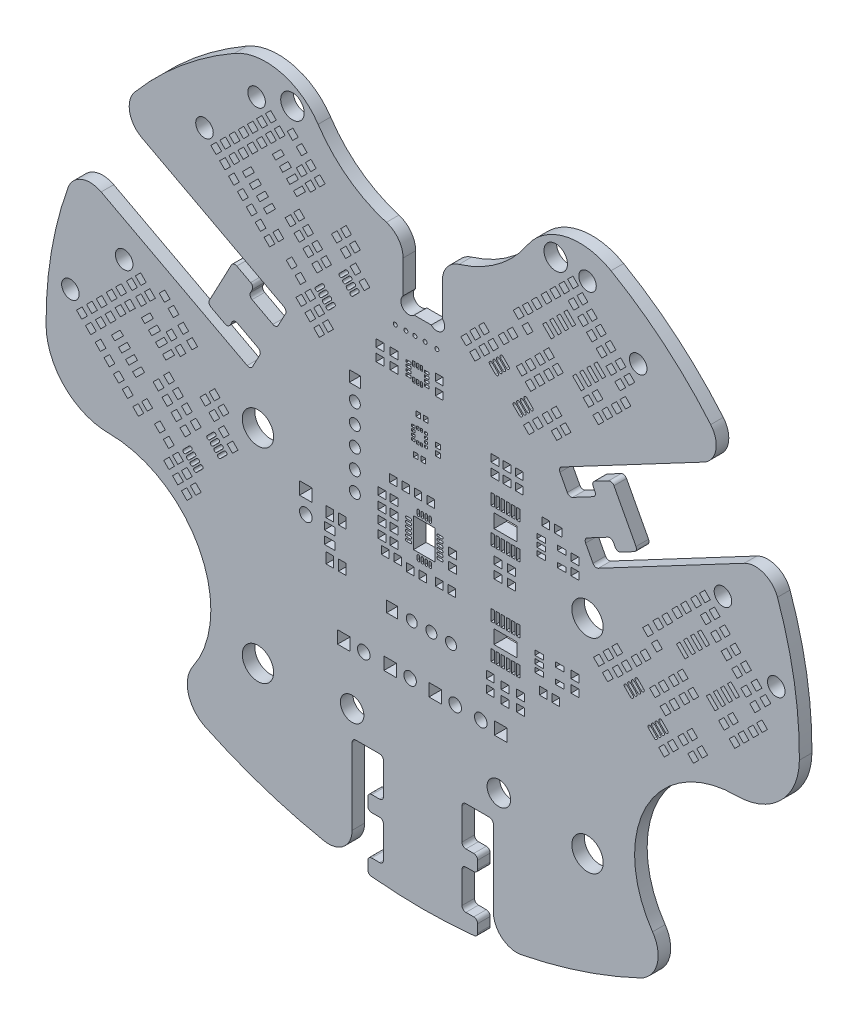
from build123d import *

# Parameters (mm, degrees)
MODEL_R            = 0.7
MODEL_R_2          = 2
MODEL_R_3          = 0.254
MODEL_R_4          = 1.1176
MODEL_R_5          = 1.5
MODEL_R_6          = 0.8
MODEL_W            = 1.4
MODEL_H            = 1.4
MODEL_W_2          = 0.4
MODEL_H_2          = 0.3
MODEL_W_3          = 0.3
MODEL_H_3          = 0.4
MODEL_W_4          = 1.1
MODEL_H_4          = 0.6
MODEL_W_5          = 0.64
MODEL_H_5          = 0.59
MODEL_W_6          = 0.59
MODEL_H_6          = 0.64
MODEL_W_7          = 0.95
MODEL_H_7          = 1.35
MODEL_W_8          = 1.35
MODEL_H_8          = 0.95
MODEL_W_9          = 2.75
MODEL_H_9          = 3.75
MODEL_W_10         = 0.45
MODEL_H_10         = 1.425
MODEL_W_11         = 2.947
MODEL_H_11         = 1.753
MODEL_W_12         = 0.6
MODEL_H_12         = 1
MODEL_W_13         = 1
MODEL_W_14         = 1.6
MODEL_H_13         = 1.6
BOSS_EXTRU_1_DEPTH = 1.6


with BuildPart() as part:
    # Model → Boss.-Extru.1 (new body)
    with BuildSketch(Plane.XY):
        with BuildLine():
            Line((0.6358, 50.4), (-1.5358, 50.4))
            ThreePointArc((-1.5358, 50.4), (-2.949992929, 50.400007071), (-2.95, 51.8142))
            Line((-2.95, 51.8142), (-2.95, 55.9955))
            ThreePointArc((-2.95, 55.9955), (-3.541133135, 57.783647085), (-5.0816, 58.8671))
            ThreePointArc((-5.0816, 58.8671), (-9.99733338, 61.34274159), (-13.7833, 65.3377))
            ThreePointArc((-13.7833, 65.3377), (-18.620170532, 68.703447655), (-24.4498, 67.8438))
            ThreePointArc((-24.4498, 67.8438), (-31.261898118, 63.079999891), (-37.15, 57.2124))
            ThreePointArc((-37.15, 57.2124), (-37.801472862, 54.707625216), (-36.261, 52.6279))
            Line((-36.261, 52.6279), (-18.142, 43.0271))
            ThreePointArc((-18.142, 43.0271), (-17.898173814, 42.732163839), (-17.9343, 42.3512))
            Line((-17.9343, 42.3512), (-18.8707, 40.584))
            ThreePointArc((-18.8707, 40.584), (-19.165676607, 40.340122008), (-19.5467, 40.3763))
            Line((-19.5467, 40.3763), (-22.1975, 41.7809))
            ThreePointArc((-22.1975, 41.7809), (-22.441333959, 42.075833772), (-22.4052, 42.4568))
            Line((-22.4052, 42.4568), (-22.1711, 42.8986))
            ThreePointArc((-22.1711, 42.8986), (-22.134971448, 43.279564566), (-22.3788, 43.5745))
            Line((-22.3788, 43.5745), (-24.1461, 44.5109))
            ThreePointArc((-24.1461, 44.5109), (-24.527065501, 44.547031594), (-24.822, 44.3032))
            Line((-24.822, 44.3032), (-27.6312, 39.0015))
            ThreePointArc((-27.6312, 39.0015), (-27.667331932, 38.620534395), (-27.4235, 38.3256))
            Line((-27.4235, 38.3256), (-25.6563, 37.3892))
            ThreePointArc((-25.6563, 37.3892), (-25.275332734, 37.353062661), (-24.9804, 37.5969))
            Line((-24.9804, 37.5969), (-24.7462, 38.0387))
            ThreePointArc((-24.7462, 38.0387), (-24.451265501, 38.282531594), (-24.0703, 38.2464))
            Line((-24.0703, 38.2464), (-21.4195, 36.8418))
            ThreePointArc((-21.4195, 36.8418), (-21.175666379, 36.546866124), (-21.2118, 36.1659))
            Line((-21.2118, 36.1659), (-22.1482, 34.3986))
            ThreePointArc((-22.1482, 34.3986), (-22.443135745, 34.154772462), (-22.8241, 34.1909))
            Line((-22.8241, 34.1909), (-41.4289, 44.0491))
            ThreePointArc((-41.4289, 44.0491), (-43.919422215, 44.1948424), (-45.659, 42.4066))
            ThreePointArc((-45.659, 42.4066), (-47.786015909, 34.239193824), (-48.4497, 25.8255))
            ThreePointArc((-48.4497, 25.8255), (-46.080470109, 20.216863723), (-40.45, 17.9))
            ThreePointArc((-40.45, 17.9), (-28.941954651, 10.946914919), (-29.7441, -2.4746))
            ThreePointArc((-29.7441, -2.4746), (-30.313200312, -5.780734401), (-28.1649, -8.3574))
            ThreePointArc((-28.1649, -8.3574), (-20.754265025, -11.328450182), (-13.0339, -13.3633))
            ThreePointArc((-13.0339, -13.3633), (-10.546288463, -12.739271591), (-9.45, -10.4207))
            Line((-9.45, -10.4207), (-9.45, -0.7199))
            ThreePointArc((-9.45, -0.7199), (-9.3035535, -0.3663465), (-8.95, -0.2199))
            Line((-8.95, -0.2199), (-5.95, -0.2199))
            ThreePointArc((-5.95, -0.2199), (-5.5964465, -0.3663465), (-5.45, -0.7199))
            Line((-5.45, -0.7199), (-5.45, -4.7199))
            ThreePointArc((-5.45, -4.7199), (-5.5964465, -5.0734535), (-5.95, -5.2199))
            Line((-5.95, -5.2199), (-6.95, -5.2199))
            ThreePointArc((-6.95, -5.2199), (-7.3035535, -5.3663465), (-7.45, -5.7199))
            Line((-7.45, -5.7199), (-7.45, -6.7199))
            ThreePointArc((-7.45, -6.7199), (-7.3035535, -7.0734535), (-6.95, -7.2199))
            Line((-6.95, -7.2199), (-5.95, -7.2199))
            ThreePointArc((-5.95, -7.2199), (-5.5964465, -7.3663465), (-5.45, -7.7199))
            Line((-5.45, -7.7199), (-5.45, -11.7199))
            ThreePointArc((-5.45, -11.7199), (-5.5964465, -12.0734535), (-5.95, -12.2199))
            Line((-5.95, -12.2199), (-6.95, -12.2199))
            ThreePointArc((-6.95, -12.2199), (-7.3035535, -12.3663465), (-7.45, -12.7199))
            Line((-7.45, -12.7199), (-7.45, -13.7698))
            ThreePointArc((-7.45, -13.7698), (-7.321040807, -14.104937233), (-7.0007, -14.2672))
            ThreePointArc((-7.0007, -14.2672), (-0.45, -14.599969009), (6.1007, -14.2672))
            ThreePointArc((6.1007, -14.2672), (6.421040807, -14.104937233), (6.55, -13.7698))
            Line((6.55, -13.7698), (6.55, -12.7199))
            ThreePointArc((6.55, -12.7199), (6.4035535, -12.3663465), (6.05, -12.2199))
            Line((6.05, -12.2199), (5.05, -12.2199))
            ThreePointArc((5.05, -12.2199), (4.6964465, -12.0734535), (4.55, -11.7199))
            Line((4.55, -11.7199), (4.55, -7.7199))
            ThreePointArc((4.55, -7.7199), (4.6964465, -7.3663465), (5.05, -7.2199))
            Line((5.05, -7.2199), (6.05, -7.2199))
            ThreePointArc((6.05, -7.2199), (6.4035535, -7.0734535), (6.55, -6.7199))
            Line((6.55, -6.7199), (6.55, -5.7199))
            ThreePointArc((6.55, -5.7199), (6.4035535, -5.3663465), (6.05, -5.2199))
            Line((6.05, -5.2199), (5.05, -5.2199))
            ThreePointArc((5.05, -5.2199), (4.6964465, -5.0734535), (4.55, -4.7199))
            Line((4.55, -4.7199), (4.55, -0.7199))
            ThreePointArc((4.55, -0.7199), (4.6964465, -0.3663465), (5.05, -0.2199))
            Line((5.05, -0.2199), (8.05, -0.2199))
            ThreePointArc((8.05, -0.2199), (8.4035535, -0.3663465), (8.55, -0.7199))
            Line((8.55, -0.7199), (8.55, -10.4207))
            ThreePointArc((8.55, -10.4207), (9.646320807, -12.739316736), (12.134, -13.3633))
            ThreePointArc((12.134, -13.3633), (19.854312522, -11.328439522), (27.2649, -8.3574))
            ThreePointArc((27.2649, -8.3574), (29.413200312, -5.780734401), (28.8441, -2.4746))
            ThreePointArc((28.8441, -2.4746), (28.041954651, 10.946914919), (39.55, 17.9))
            ThreePointArc((39.55, 17.9), (45.180470109, 20.216863723), (47.5497, 25.8255))
            ThreePointArc((47.5497, 25.8255), (46.886015909, 34.239193824), (44.759, 42.4066))
            ThreePointArc((44.759, 42.4066), (43.019422169, 44.194842618), (40.528899769, 44.049100153))
            Line((40.528899769, 44.049100153), (21.924099769, 34.190900153))
            ThreePointArc((21.924099769, 34.190900153), (21.543135514, 34.154772615), (21.248199769, 34.398600153))
            Line((21.248199769, 34.398600153), (20.311799769, 36.165900153))
            ThreePointArc((20.311799769, 36.165900153), (20.275666147, 36.546866277), (20.519499769, 36.841800153))
            Line((20.519499769, 36.841800153), (23.170299769, 38.246400153))
            ThreePointArc((23.170299769, 38.246400153), (23.55126527, 38.282531747), (23.846199769, 38.038700153))
            Line((23.846199769, 38.038700153), (24.080399769, 37.596900153))
            ThreePointArc((24.080399769, 37.596900153), (24.375332503, 37.353062815), (24.756299769, 37.389200153))
            Line((24.756299769, 37.389200153), (26.523499769, 38.325600153))
            ThreePointArc((26.523499769, 38.325600153), (26.7673317, 38.620534549), (26.731199769, 39.001500153))
            Line((26.731199769, 39.001500153), (23.921999769, 44.303200153))
            ThreePointArc((23.921999769, 44.303200153), (23.62706527, 44.547031747), (23.246099769, 44.510900153))
            Line((23.246099769, 44.510900153), (21.478799769, 43.574500153))
            ThreePointArc((21.478799769, 43.574500153), (21.234971217, 43.27956472), (21.271099769, 42.898600153))
            Line((21.271099769, 42.898600153), (21.505199769, 42.456800153))
            ThreePointArc((21.505199769, 42.456800153), (21.541333728, 42.075833926), (21.297499769, 41.780900153))
            Line((21.297499769, 41.780900153), (18.646699769, 40.376300153))
            ThreePointArc((18.646699769, 40.376300153), (18.265676375, 40.340122161), (17.970699769, 40.584000153))
            Line((17.970699769, 40.584000153), (17.034299769, 42.351200153))
            ThreePointArc((17.034299769, 42.351200153), (16.998173582, 42.732163993), (17.241999769, 43.027100153))
            Line((17.241999769, 43.027100153), (35.360999769, 52.627900153))
            ThreePointArc((35.360999769, 52.627900153), (36.901472631, 54.707625369), (36.249999769, 57.212400153))
            ThreePointArc((36.249999769, 57.212400153), (30.361897887, 63.080000045), (23.549799769, 67.843800153))
            ThreePointArc((23.549799769, 67.843800153), (17.720170301, 68.703447809), (12.883299769, 65.337700153))
            ThreePointArc((12.883299769, 65.337700153), (9.09733332, 61.34274159), (4.18160008, 58.867099734))
            ThreePointArc((4.18160008, 58.867099734), (2.641133246, 57.783646945), (2.05, 55.9955))
            Line((2.05, 55.9955), (2.05, 51.8142))
            ThreePointArc((2.05, 51.8142), (2.049992929, 50.400007071), (0.6358, 50.4))
        make_face()
        with Locations((-9.1, 37.05)):
            Circle(MODEL_R, mode=Mode.SUBTRACT)
        with Locations((-9.1, 34.55)):
            Circle(MODEL_R, mode=Mode.SUBTRACT)
        with Locations((-9.1, 32.05)):
            Circle(MODEL_R, mode=Mode.SUBTRACT)
        with Locations((-9.1, 29.55)):
            Circle(MODEL_R, mode=Mode.SUBTRACT)
        with Locations((-9.1, 27.05)):
            Circle(MODEL_R, mode=Mode.SUBTRACT)
        with Locations((20.55, 2)):
            Circle(MODEL_R_2, mode=Mode.SUBTRACT)
        with Locations((-21.45, 2)):
            Circle(MODEL_R_2, mode=Mode.SUBTRACT)
        with Locations((20.55, 28)):
            Circle(MODEL_R_2, mode=Mode.SUBTRACT)
        with Locations((-21.45, 28)):
            Circle(MODEL_R_2, mode=Mode.SUBTRACT)
        with Locations((-3.95, 48.15)):
            Circle(MODEL_R_3, mode=Mode.SUBTRACT)
        with Locations((-2.6, 48.15)):
            Circle(MODEL_R_3, mode=Mode.SUBTRACT)
        with Locations((-1.45, 48.15)):
            Circle(MODEL_R_3, mode=Mode.SUBTRACT)
        with Locations((-0.15, 48.15)):
            Circle(MODEL_R_3, mode=Mode.SUBTRACT)
        with Locations((1.35, 48.1)):
            Circle(MODEL_R_3, mode=Mode.SUBTRACT)
        with Locations((-45.35, 31.35)):
            Circle(MODEL_R_4, mode=Mode.SUBTRACT)
        with Locations((-38.5, 38.05)):
            Circle(MODEL_R_4, mode=Mode.SUBTRACT)
        with Locations((37.8111, 39.0384)):
            Circle(MODEL_R_4, mode=Mode.SUBTRACT)
        with Locations((20.55, 65.2)):
            Circle(MODEL_R_4, mode=Mode.SUBTRACT)
        with Locations((-28.2608, 57.7142)):
            Circle(MODEL_R_4, mode=Mode.SUBTRACT)
        with Locations((27.0079, 59.2916)):
            Circle(MODEL_R_4, mode=Mode.SUBTRACT)
        with Locations((44.6059, 32.4746)):
            Circle(MODEL_R_4, mode=Mode.SUBTRACT)
        with Locations((-21.6261, 64.4282)):
            Circle(MODEL_R_4, mode=Mode.SUBTRACT)
        with Locations((-17.05, 65.7)):
            Circle(MODEL_R_5, mode=Mode.SUBTRACT)
        with Locations((-9.45, 3)):
            Circle(MODEL_R_5, mode=Mode.SUBTRACT)
        with Locations((9.25, 3.05)):
            Circle(MODEL_R_5, mode=Mode.SUBTRACT)
        with Locations((16.5, 65.8)):
            Circle(MODEL_R_5, mode=Mode.SUBTRACT)
        with Locations((-1.85, 16.5)):
            Circle(MODEL_R, mode=Mode.SUBTRACT)
        with Locations((0.65, 16.5)):
            Circle(MODEL_R, mode=Mode.SUBTRACT)
        with Locations((3.15, 16.5)):
            Circle(MODEL_R, mode=Mode.SUBTRACT)
        with Locations((6.95, 9.95)):
            Circle(MODEL_R_6, mode=Mode.SUBTRACT)
        with Locations((-7.96, 10)):
            Circle(MODEL_R_6, mode=Mode.SUBTRACT)
        with Locations((3.69, 10)):
            Circle(MODEL_R_6, mode=Mode.SUBTRACT)
        with Locations((-2.06, 10.05)):
            Circle(MODEL_R_6, mode=Mode.SUBTRACT)
        with Locations((-15.35, 21.48)):
            Circle(MODEL_R_6, mode=Mode.SUBTRACT)
        with Locations((-9.1, 39.55)):
            Rectangle(MODEL_W, MODEL_H, mode=Mode.SUBTRACT)
        with Locations((-0.05, 36.6)):
            Rectangle(MODEL_W_2, MODEL_H_2, mode=Mode.SUBTRACT)
        with Locations((-0.05, 37.1)):
            Rectangle(MODEL_W_2, MODEL_H_2, mode=Mode.SUBTRACT)
        with Locations((-0.05, 37.6)):
            Rectangle(MODEL_W_2, MODEL_H_2, mode=Mode.SUBTRACT)
        with Locations((-0.05, 38.1)):
            Rectangle(MODEL_W_2, MODEL_H_2, mode=Mode.SUBTRACT)
        with Locations((-0.6, 38.15)):
            Rectangle(MODEL_W_3, MODEL_H_3, mode=Mode.SUBTRACT)
        with Locations((-1.1, 38.15)):
            Rectangle(MODEL_W_3, MODEL_H_3, mode=Mode.SUBTRACT)
        with Locations((-1.65, 38.1)):
            Rectangle(MODEL_W_2, MODEL_H_2, mode=Mode.SUBTRACT)
        with Locations((-1.65, 37.6)):
            Rectangle(MODEL_W_2, MODEL_H_2, mode=Mode.SUBTRACT)
        with Locations((-1.65, 37.1)):
            Rectangle(MODEL_W_2, MODEL_H_2, mode=Mode.SUBTRACT)
        with Locations((-1.65, 36.6)):
            Rectangle(MODEL_W_2, MODEL_H_2, mode=Mode.SUBTRACT)
        with Locations((-1.1, 36.55)):
            Rectangle(MODEL_W_3, MODEL_H_3, mode=Mode.SUBTRACT)
        with Locations((-0.6, 36.55)):
            Rectangle(MODEL_W_3, MODEL_H_3, mode=Mode.SUBTRACT)
        with Locations((14.4, 20.85)):
            Rectangle(MODEL_W_4, MODEL_H_4, mode=Mode.SUBTRACT)
        with Locations((14.4, 19.9)):
            Rectangle(MODEL_W_4, MODEL_H_4, mode=Mode.SUBTRACT)
        with Locations((14.4, 18.95)):
            Rectangle(MODEL_W_4, MODEL_H_4, mode=Mode.SUBTRACT)
        with Locations((17, 18.95)):
            Rectangle(MODEL_W_4, MODEL_H_4, mode=Mode.SUBTRACT)
        with Locations((17, 20.85)):
            Rectangle(MODEL_W_4, MODEL_H_4, mode=Mode.SUBTRACT)
        with Locations((14.65, 33.85)):
            Rectangle(MODEL_W_4, MODEL_H_4, mode=Mode.SUBTRACT)
        with Locations((14.65, 32.9)):
            Rectangle(MODEL_W_4, MODEL_H_4, mode=Mode.SUBTRACT)
        with Locations((14.65, 31.95)):
            Rectangle(MODEL_W_4, MODEL_H_4, mode=Mode.SUBTRACT)
        with Locations((17.25, 31.95)):
            Rectangle(MODEL_W_4, MODEL_H_4, mode=Mode.SUBTRACT)
        with Locations((17.25, 33.85)):
            Rectangle(MODEL_W_4, MODEL_H_4, mode=Mode.SUBTRACT)
        with Locations((1.5, 36.52)):
            Rectangle(MODEL_W_5, MODEL_H_5, mode=Mode.SUBTRACT)
        with Locations((1.5, 37.48)):
            Rectangle(MODEL_W_5, MODEL_H_5, mode=Mode.SUBTRACT)
        with Locations((-0.37, 35)):
            Rectangle(MODEL_W_6, MODEL_H_6, mode=Mode.SUBTRACT)
        with Locations((-1.33, 35)):
            Rectangle(MODEL_W_6, MODEL_H_6, mode=Mode.SUBTRACT)
        with Locations((-0.07, 39.65)):
            Rectangle(MODEL_W_6, MODEL_H_6, mode=Mode.SUBTRACT)
        with Locations((-1.03, 39.65)):
            Rectangle(MODEL_W_6, MODEL_H_6, mode=Mode.SUBTRACT)
        with Locations((-10.7, 23.1)):
            Rectangle(MODEL_W_7, MODEL_H_7, mode=Mode.SUBTRACT)
        with Locations((-12.3, 23.1)):
            Rectangle(MODEL_W_7, MODEL_H_7, mode=Mode.SUBTRACT)
        with Locations((-10.7, 18)):
            Rectangle(MODEL_W_7, MODEL_H_7, mode=Mode.SUBTRACT)
        with Locations((-12.3, 18)):
            Rectangle(MODEL_W_7, MODEL_H_7, mode=Mode.SUBTRACT)
        with Locations((-12.3, 21.45)):
            Rectangle(MODEL_W_8, MODEL_H_8, mode=Mode.SUBTRACT)
        with Locations((-12.3, 19.85)):
            Rectangle(MODEL_W_8, MODEL_H_8, mode=Mode.SUBTRACT)
        with BuildLine():
            Line((27.398932, 23.42897), (26.65647, 24.171432))
            ThreePointArc((26.65647, 24.171432), (26.65647, 24.48963), (26.974668, 24.48963))
            Line((26.974668, 24.48963), (27.71713, 23.747168))
            ThreePointArc((27.71713, 23.747168), (27.71713, 23.42897), (27.398932, 23.42897))
        make_face(mode=Mode.SUBTRACT)
        with BuildLine():
            Line((26.939332, 22.96937), (26.19687, 23.711832))
            ThreePointArc((26.19687, 23.711832), (26.19687, 24.03003), (26.515068, 24.03003))
            Line((26.515068, 24.03003), (27.25753, 23.287568))
            ThreePointArc((27.25753, 23.287568), (27.25753, 22.96937), (26.939332, 22.96937))
        make_face(mode=Mode.SUBTRACT)
        with BuildLine():
            Line((26.479732, 22.50977), (25.73727, 23.252232))
            ThreePointArc((25.73727, 23.252232), (25.73727, 23.57043), (26.055468, 23.57043))
            Line((26.055468, 23.57043), (26.79793, 22.827968))
            ThreePointArc((26.79793, 22.827968), (26.79793, 22.50977), (26.479732, 22.50977))
        make_face(mode=Mode.SUBTRACT)
        with BuildLine():
            Line((26.020132, 22.05017), (25.27767, 22.792632))
            ThreePointArc((25.27767, 22.792632), (25.27767, 23.11083), (25.595868, 23.11083))
            Line((25.595868, 23.11083), (26.33833, 22.368368))
            ThreePointArc((26.33833, 22.368368), (26.33833, 22.05017), (26.020132, 22.05017))
        make_face(mode=Mode.SUBTRACT)
        with BuildLine():
            Line((29.060732, 19.00957), (28.31827, 19.752032))
            ThreePointArc((28.31827, 19.752032), (28.31827, 20.07023), (28.636468, 20.07023))
            Line((28.636468, 20.07023), (29.37893, 19.327768))
            ThreePointArc((29.37893, 19.327768), (29.37893, 19.00957), (29.060732, 19.00957))
        make_face(mode=Mode.SUBTRACT)
        with BuildLine():
            Line((29.520332, 19.46917), (28.77787, 20.211632))
            ThreePointArc((28.77787, 20.211632), (28.77787, 20.52983), (29.096068, 20.52983))
            Line((29.096068, 20.52983), (29.83853, 19.787368))
            ThreePointArc((29.83853, 19.787368), (29.83853, 19.46917), (29.520332, 19.46917))
        make_face(mode=Mode.SUBTRACT)
        with BuildLine():
            Line((29.979932, 19.92877), (29.23747, 20.671232))
            ThreePointArc((29.23747, 20.671232), (29.23747, 20.98943), (29.555668, 20.98943))
            Line((29.555668, 20.98943), (30.29813, 20.246968))
            ThreePointArc((30.29813, 20.246968), (30.29813, 19.92877), (29.979932, 19.92877))
        make_face(mode=Mode.SUBTRACT)
        with BuildLine():
            Line((30.439532, 20.38837), (29.69707, 21.130832))
            ThreePointArc((29.69707, 21.130832), (29.69707, 21.44903), (30.015268, 21.44903))
            Line((30.015268, 21.44903), (30.75773, 20.706568))
            ThreePointArc((30.75773, 20.706568), (30.75773, 20.38837), (30.439532, 20.38837))
        make_face(mode=Mode.SUBTRACT)
        with BuildLine():
            Line((-29.89217, 21.304932), (-30.634632, 20.56247))
            ThreePointArc((-30.634632, 20.56247), (-30.95283, 20.56247), (-30.95283, 20.880668))
            Line((-30.95283, 20.880668), (-30.210368, 21.62313))
            ThreePointArc((-30.210368, 21.62313), (-29.89217, 21.62313), (-29.89217, 21.304932))
        make_face(mode=Mode.SUBTRACT)
        with BuildLine():
            Line((-29.43257, 20.845332), (-30.175032, 20.10287))
            ThreePointArc((-30.175032, 20.10287), (-30.49323, 20.10287), (-30.49323, 20.421068))
            Line((-30.49323, 20.421068), (-29.750768, 21.16353))
            ThreePointArc((-29.750768, 21.16353), (-29.43257, 21.16353), (-29.43257, 20.845332))
        make_face(mode=Mode.SUBTRACT)
        with BuildLine():
            Line((-28.97297, 20.385732), (-29.715432, 19.64327))
            ThreePointArc((-29.715432, 19.64327), (-30.03363, 19.64327), (-30.03363, 19.961468))
            Line((-30.03363, 19.961468), (-29.291168, 20.70393))
            ThreePointArc((-29.291168, 20.70393), (-28.97297, 20.70393), (-28.97297, 20.385732))
        make_face(mode=Mode.SUBTRACT)
        with BuildLine():
            Line((-28.51337, 19.926132), (-29.255832, 19.18367))
            ThreePointArc((-29.255832, 19.18367), (-29.57403, 19.18367), (-29.57403, 19.501868))
            Line((-29.57403, 19.501868), (-28.831568, 20.24433))
            ThreePointArc((-28.831568, 20.24433), (-28.51337, 20.24433), (-28.51337, 19.926132))
        make_face(mode=Mode.SUBTRACT)
        with BuildLine():
            Line((-25.47277, 22.966732), (-26.215232, 22.22427))
            ThreePointArc((-26.215232, 22.22427), (-26.53343, 22.22427), (-26.53343, 22.542468))
            Line((-26.53343, 22.542468), (-25.790968, 23.28493))
            ThreePointArc((-25.790968, 23.28493), (-25.47277, 23.28493), (-25.47277, 22.966732))
        make_face(mode=Mode.SUBTRACT)
        with BuildLine():
            Line((-25.93237, 23.426332), (-26.674832, 22.68387))
            ThreePointArc((-26.674832, 22.68387), (-26.99303, 22.68387), (-26.99303, 23.002068))
            Line((-26.99303, 23.002068), (-26.250568, 23.74453))
            ThreePointArc((-26.250568, 23.74453), (-25.93237, 23.74453), (-25.93237, 23.426332))
        make_face(mode=Mode.SUBTRACT)
        with BuildLine():
            Line((-26.39197, 23.885932), (-27.134432, 23.14347))
            ThreePointArc((-27.134432, 23.14347), (-27.45263, 23.14347), (-27.45263, 23.461668))
            Line((-27.45263, 23.461668), (-26.710168, 24.20413))
            ThreePointArc((-26.710168, 24.20413), (-26.39197, 24.20413), (-26.39197, 23.885932))
        make_face(mode=Mode.SUBTRACT)
        with BuildLine():
            Line((-26.85157, 24.345532), (-27.594032, 23.60307))
            ThreePointArc((-27.594032, 23.60307), (-27.91223, 23.60307), (-27.91223, 23.921268))
            Line((-27.91223, 23.921268), (-27.169768, 24.66373))
            ThreePointArc((-27.169768, 24.66373), (-26.85157, 24.66373), (-26.85157, 24.345532))
        make_face(mode=Mode.SUBTRACT)
        with BuildLine():
            Line((10.205532, 50.42797), (9.46307, 51.170432))
            ThreePointArc((9.46307, 51.170432), (9.46307, 51.48863), (9.781268, 51.48863))
            Line((9.781268, 51.48863), (10.52373, 50.746168))
            ThreePointArc((10.52373, 50.746168), (10.52373, 50.42797), (10.205532, 50.42797))
        make_face(mode=Mode.SUBTRACT)
        with BuildLine():
            Line((9.745932, 49.96837), (9.00347, 50.710832))
            ThreePointArc((9.00347, 50.710832), (9.00347, 51.02903), (9.321668, 51.02903))
            Line((9.321668, 51.02903), (10.06413, 50.286568))
            ThreePointArc((10.06413, 50.286568), (10.06413, 49.96837), (9.745932, 49.96837))
        make_face(mode=Mode.SUBTRACT)
        with BuildLine():
            Line((9.286332, 49.50877), (8.54387, 50.251232))
            ThreePointArc((8.54387, 50.251232), (8.54387, 50.56943), (8.862068, 50.56943))
            Line((8.862068, 50.56943), (9.60453, 49.826968))
            ThreePointArc((9.60453, 49.826968), (9.60453, 49.50877), (9.286332, 49.50877))
        make_face(mode=Mode.SUBTRACT)
        with BuildLine():
            Line((8.826732, 49.04917), (8.08427, 49.791632))
            ThreePointArc((8.08427, 49.791632), (8.08427, 50.10983), (8.402468, 50.10983))
            Line((8.402468, 50.10983), (9.14493, 49.367368))
            ThreePointArc((9.14493, 49.367368), (9.14493, 49.04917), (8.826732, 49.04917))
        make_face(mode=Mode.SUBTRACT)
        with BuildLine():
            Line((11.867332, 46.00857), (11.12487, 46.751032))
            ThreePointArc((11.12487, 46.751032), (11.12487, 47.06923), (11.443068, 47.06923))
            Line((11.443068, 47.06923), (12.18553, 46.326768))
            ThreePointArc((12.18553, 46.326768), (12.18553, 46.00857), (11.867332, 46.00857))
        make_face(mode=Mode.SUBTRACT)
        with BuildLine():
            Line((12.326932, 46.46817), (11.58447, 47.210632))
            ThreePointArc((11.58447, 47.210632), (11.58447, 47.52883), (11.902668, 47.52883))
            Line((11.902668, 47.52883), (12.64513, 46.786368))
            ThreePointArc((12.64513, 46.786368), (12.64513, 46.46817), (12.326932, 46.46817))
        make_face(mode=Mode.SUBTRACT)
        with BuildLine():
            Line((12.786532, 46.92777), (12.04407, 47.670232))
            ThreePointArc((12.04407, 47.670232), (12.04407, 47.98843), (12.362268, 47.98843))
            Line((12.362268, 47.98843), (13.10473, 47.245968))
            ThreePointArc((13.10473, 47.245968), (13.10473, 46.92777), (12.786532, 46.92777))
        make_face(mode=Mode.SUBTRACT)
        with BuildLine():
            Line((13.246132, 47.38737), (12.50367, 48.129832))
            ThreePointArc((12.50367, 48.129832), (12.50367, 48.44803), (12.821868, 48.44803))
            Line((12.821868, 48.44803), (13.56433, 47.705568))
            ThreePointArc((13.56433, 47.705568), (13.56433, 47.38737), (13.246132, 47.38737))
        make_face(mode=Mode.SUBTRACT)
        with BuildLine():
            Line((-13.03167, 47.650932), (-13.774132, 46.90847))
            ThreePointArc((-13.774132, 46.90847), (-14.09233, 46.90847), (-14.09233, 47.226668))
            Line((-14.09233, 47.226668), (-13.349868, 47.96913))
            ThreePointArc((-13.349868, 47.96913), (-13.03167, 47.96913), (-13.03167, 47.650932))
        make_face(mode=Mode.SUBTRACT)
        with BuildLine():
            Line((-12.57207, 47.191332), (-13.314532, 46.44887))
            ThreePointArc((-13.314532, 46.44887), (-13.63273, 46.44887), (-13.63273, 46.767068))
            Line((-13.63273, 46.767068), (-12.890268, 47.50953))
            ThreePointArc((-12.890268, 47.50953), (-12.57207, 47.50953), (-12.57207, 47.191332))
        make_face(mode=Mode.SUBTRACT)
        with BuildLine():
            Line((-12.11247, 46.731732), (-12.854932, 45.98927))
            ThreePointArc((-12.854932, 45.98927), (-13.17313, 45.98927), (-13.17313, 46.307468))
            Line((-13.17313, 46.307468), (-12.430668, 47.04993))
            ThreePointArc((-12.430668, 47.04993), (-12.11247, 47.04993), (-12.11247, 46.731732))
        make_face(mode=Mode.SUBTRACT)
        with BuildLine():
            Line((-11.65287, 46.272132), (-12.395332, 45.52967))
            ThreePointArc((-12.395332, 45.52967), (-12.71353, 45.52967), (-12.71353, 45.847868))
            Line((-12.71353, 45.847868), (-11.971068, 46.59033))
            ThreePointArc((-11.971068, 46.59033), (-11.65287, 46.59033), (-11.65287, 46.272132))
        make_face(mode=Mode.SUBTRACT)
        with BuildLine():
            Line((-8.61227, 49.312732), (-9.354732, 48.57027))
            ThreePointArc((-9.354732, 48.57027), (-9.67293, 48.57027), (-9.67293, 48.888468))
            Line((-9.67293, 48.888468), (-8.930468, 49.63093))
            ThreePointArc((-8.930468, 49.63093), (-8.61227, 49.63093), (-8.61227, 49.312732))
        make_face(mode=Mode.SUBTRACT)
        with BuildLine():
            Line((-9.07187, 49.772332), (-9.814332, 49.02987))
            ThreePointArc((-9.814332, 49.02987), (-10.13253, 49.02987), (-10.13253, 49.348068))
            Line((-10.13253, 49.348068), (-9.390068, 50.09053))
            ThreePointArc((-9.390068, 50.09053), (-9.07187, 50.09053), (-9.07187, 49.772332))
        make_face(mode=Mode.SUBTRACT)
        with BuildLine():
            Line((-9.53147, 50.231932), (-10.273932, 49.48947))
            ThreePointArc((-10.273932, 49.48947), (-10.59213, 49.48947), (-10.59213, 49.807668))
            Line((-10.59213, 49.807668), (-9.849668, 50.55013))
            ThreePointArc((-9.849668, 50.55013), (-9.53147, 50.55013), (-9.53147, 50.231932))
        make_face(mode=Mode.SUBTRACT)
        with BuildLine():
            Line((-9.99107, 50.691532), (-10.733532, 49.94907))
            ThreePointArc((-10.733532, 49.94907), (-11.05173, 49.94907), (-11.05173, 50.267268))
            Line((-11.05173, 50.267268), (-10.309268, 51.00973))
            ThreePointArc((-10.309268, 51.00973), (-9.99107, 51.00973), (-9.99107, 50.691532))
        make_face(mode=Mode.SUBTRACT)
        Polygon((37.22414, 26.324624), (36.799876, 25.90036), (35.70386, 26.996376), (36.128124, 27.42064), align=None, mode=Mode.SUBTRACT)
        Polygon((38.12224, 27.222624), (37.697976, 26.79836), (36.60196, 27.894376), (37.026224, 28.31864), align=None, mode=Mode.SUBTRACT)
        Polygon((39.02024, 28.120624), (38.595976, 27.69636), (37.49996, 28.792376), (37.924224, 29.21664), align=None, mode=Mode.SUBTRACT)
        Polygon((39.91824, 29.018724), (39.493976, 28.59446), (38.39796, 29.690476), (38.822224, 30.11474), align=None, mode=Mode.SUBTRACT)
        Polygon((36.09994, 32.837024), (35.675676, 32.41276), (34.57966, 33.508776), (35.003924, 33.93304), align=None, mode=Mode.SUBTRACT)
        Polygon((35.20184, 31.939024), (34.777576, 31.51476), (33.68156, 32.610776), (34.105824, 33.03504), align=None, mode=Mode.SUBTRACT)
        Polygon((34.30384, 31.041024), (33.879576, 30.61676), (32.78356, 31.712776), (33.207824, 32.13704), align=None, mode=Mode.SUBTRACT)
        Polygon((33.40584, 30.142924), (32.981576, 29.71866), (31.88556, 30.814676), (32.309824, 31.23894), align=None, mode=Mode.SUBTRACT)
        Polygon((-32.505024, 31.13024), (-32.08076, 30.705976), (-33.176776, 29.60996), (-33.60104, 30.034224), align=None, mode=Mode.SUBTRACT)
        Polygon((-33.403024, 32.02834), (-32.97876, 31.604076), (-34.074776, 30.50806), (-34.49904, 30.932324), align=None, mode=Mode.SUBTRACT)
        Polygon((-34.301024, 32.92634), (-33.87676, 32.502076), (-34.972776, 31.40606), (-35.39704, 31.830324), align=None, mode=Mode.SUBTRACT)
        Polygon((-35.199124, 33.82434), (-34.77486, 33.400076), (-35.870876, 32.30406), (-36.29514, 32.728324), align=None, mode=Mode.SUBTRACT)
        Polygon((-39.017424, 30.00604), (-38.59316, 29.581776), (-39.689176, 28.48576), (-40.11344, 28.910024), align=None, mode=Mode.SUBTRACT)
        Polygon((-38.119424, 29.10794), (-37.69516, 28.683676), (-38.791176, 27.58766), (-39.21544, 28.011924), align=None, mode=Mode.SUBTRACT)
        Polygon((-37.221424, 28.20994), (-36.79716, 27.785676), (-37.893176, 26.68966), (-38.31744, 27.113924), align=None, mode=Mode.SUBTRACT)
        Polygon((-36.323324, 27.31194), (-35.89906, 26.887676), (-36.995076, 25.79166), (-37.41934, 26.215924), align=None, mode=Mode.SUBTRACT)
        Polygon((20.17224, 53.111524), (19.747976, 52.68726), (18.65196, 53.783276), (19.076224, 54.20754), align=None, mode=Mode.SUBTRACT)
        Polygon((21.07034, 54.009524), (20.646076, 53.58526), (19.55006, 54.681276), (19.974324, 55.10554), align=None, mode=Mode.SUBTRACT)
        Polygon((21.96834, 54.907524), (21.544076, 54.48326), (20.44806, 55.579276), (20.872324, 56.00354), align=None, mode=Mode.SUBTRACT)
        Polygon((22.86634, 55.805624), (22.442076, 55.38136), (21.34606, 56.477376), (21.770324, 56.90164), align=None, mode=Mode.SUBTRACT)
        Polygon((19.04804, 59.623924), (18.623776, 59.19966), (17.52776, 60.295676), (17.952024, 60.71994), align=None, mode=Mode.SUBTRACT)
        Polygon((18.14994, 58.725924), (17.725676, 58.30166), (16.62966, 59.397676), (17.053924, 59.82194), align=None, mode=Mode.SUBTRACT)
        Polygon((17.25194, 57.827924), (16.827676, 57.40366), (15.73166, 58.499676), (16.155924, 58.92394), align=None, mode=Mode.SUBTRACT)
        Polygon((16.35394, 56.929824), (15.929676, 56.50556), (14.83366, 57.601576), (15.257924, 58.02584), align=None, mode=Mode.SUBTRACT)
        Polygon((-15.821324, 57.51154), (-15.39706, 57.087276), (-16.493076, 55.99126), (-16.91734, 56.415524), align=None, mode=Mode.SUBTRACT)
        Polygon((-16.719324, 58.40964), (-16.29506, 57.985376), (-17.391076, 56.88936), (-17.81534, 57.313624), align=None, mode=Mode.SUBTRACT)
        Polygon((-17.617324, 59.30764), (-17.19306, 58.883376), (-18.289076, 57.78736), (-18.71334, 58.211624), align=None, mode=Mode.SUBTRACT)
        Polygon((-18.515424, 60.20564), (-18.09116, 59.781376), (-19.187176, 58.68536), (-19.61144, 59.109624), align=None, mode=Mode.SUBTRACT)
        Polygon((-22.333724, 56.38734), (-21.90946, 55.963076), (-23.005476, 54.86706), (-23.42974, 55.291324), align=None, mode=Mode.SUBTRACT)
        Polygon((-21.435724, 55.48924), (-21.01146, 55.064976), (-22.107476, 53.96896), (-22.53174, 54.393224), align=None, mode=Mode.SUBTRACT)
        Polygon((-20.537724, 54.59124), (-20.11346, 54.166976), (-21.209476, 53.07096), (-21.63374, 53.495224), align=None, mode=Mode.SUBTRACT)
        Polygon((-19.639624, 53.69324), (-19.21536, 53.268976), (-20.311376, 52.17296), (-20.73564, 52.597224), align=None, mode=Mode.SUBTRACT)
        with BuildLine():
            Line((1.5, 25.25), (2, 25.25))
            ThreePointArc((2, 25.25), (2.15, 25.1), (2, 24.95))
            Line((2, 24.95), (1.5, 24.95))
            ThreePointArc((1.5, 24.95), (1.35, 25.1), (1.5, 25.25))
        make_face(mode=Mode.SUBTRACT)
        with BuildLine():
            Line((1.5, 25.75), (2, 25.75))
            ThreePointArc((2, 25.75), (2.15, 25.6), (2, 25.45))
            Line((2, 25.45), (1.5, 25.45))
            ThreePointArc((1.5, 25.45), (1.35, 25.6), (1.5, 25.75))
        make_face(mode=Mode.SUBTRACT)
        with BuildLine():
            Line((1.5, 26.25), (2, 26.25))
            ThreePointArc((2, 26.25), (2.15, 26.1), (2, 25.95))
            Line((2, 25.95), (1.5, 25.95))
            ThreePointArc((1.5, 25.95), (1.35, 26.1), (1.5, 26.25))
        make_face(mode=Mode.SUBTRACT)
        with BuildLine():
            Line((1.5, 26.75), (2, 26.75))
            ThreePointArc((2, 26.75), (2.15, 26.6), (2, 26.45))
            Line((2, 26.45), (1.5, 26.45))
            ThreePointArc((1.5, 26.45), (1.35, 26.6), (1.5, 26.75))
        make_face(mode=Mode.SUBTRACT)
        with BuildLine():
            Line((1.5, 27.25), (2, 27.25))
            ThreePointArc((2, 27.25), (2.15, 27.1), (2, 26.95))
            Line((2, 26.95), (1.5, 26.95))
            ThreePointArc((1.5, 26.95), (1.35, 27.1), (1.5, 27.25))
        make_face(mode=Mode.SUBTRACT)
        with BuildLine():
            Line((1.5, 27.75), (2, 27.75))
            ThreePointArc((2, 27.75), (2.15, 27.6), (2, 27.45))
            Line((2, 27.45), (1.5, 27.45))
            ThreePointArc((1.5, 27.45), (1.35, 27.6), (1.5, 27.75))
        make_face(mode=Mode.SUBTRACT)
        with BuildLine():
            Line((0.35, 28.6), (0.35, 29.1))
            ThreePointArc((0.35, 29.1), (0.5, 29.25), (0.65, 29.1))
            Line((0.65, 29.1), (0.65, 28.6))
            ThreePointArc((0.65, 28.6), (0.5, 28.45), (0.35, 28.6))
        make_face(mode=Mode.SUBTRACT)
        with BuildLine():
            Line((-0.15, 28.6), (-0.15, 29.1))
            ThreePointArc((-0.15, 29.1), (0, 29.25), (0.15, 29.1))
            Line((0.15, 29.1), (0.15, 28.6))
            ThreePointArc((0.15, 28.6), (0, 28.45), (-0.15, 28.6))
        make_face(mode=Mode.SUBTRACT)
        with BuildLine():
            Line((-0.65, 28.6), (-0.65, 29.1))
            ThreePointArc((-0.65, 29.1), (-0.5, 29.25), (-0.35, 29.1))
            Line((-0.35, 29.1), (-0.35, 28.6))
            ThreePointArc((-0.35, 28.6), (-0.5, 28.45), (-0.65, 28.6))
        make_face(mode=Mode.SUBTRACT)
        with BuildLine():
            Line((-1.15, 28.6), (-1.15, 29.1))
            ThreePointArc((-1.15, 29.1), (-1, 29.25), (-0.85, 29.1))
            Line((-0.85, 29.1), (-0.85, 28.6))
            ThreePointArc((-0.85, 28.6), (-1, 28.45), (-1.15, 28.6))
        make_face(mode=Mode.SUBTRACT)
        with BuildLine():
            Line((-2.5, 27.75), (-2, 27.75))
            ThreePointArc((-2, 27.75), (-1.85, 27.6), (-2, 27.45))
            Line((-2, 27.45), (-2.5, 27.45))
            ThreePointArc((-2.5, 27.45), (-2.65, 27.6), (-2.5, 27.75))
        make_face(mode=Mode.SUBTRACT)
        with BuildLine():
            Line((-2.5, 27.25), (-2, 27.25))
            ThreePointArc((-2, 27.25), (-1.85, 27.1), (-2, 26.95))
            Line((-2, 26.95), (-2.5, 26.95))
            ThreePointArc((-2.5, 26.95), (-2.65, 27.1), (-2.5, 27.25))
        make_face(mode=Mode.SUBTRACT)
        with BuildLine():
            Line((-2.5, 26.75), (-2, 26.75))
            ThreePointArc((-2, 26.75), (-1.85, 26.6), (-2, 26.45))
            Line((-2, 26.45), (-2.5, 26.45))
            ThreePointArc((-2.5, 26.45), (-2.65, 26.6), (-2.5, 26.75))
        make_face(mode=Mode.SUBTRACT)
        with BuildLine():
            Line((-2.5, 26.25), (-2, 26.25))
            ThreePointArc((-2, 26.25), (-1.85, 26.1), (-2, 25.95))
            Line((-2, 25.95), (-2.5, 25.95))
            ThreePointArc((-2.5, 25.95), (-2.65, 26.1), (-2.5, 26.25))
        make_face(mode=Mode.SUBTRACT)
        with BuildLine():
            Line((-2.5, 25.75), (-2, 25.75))
            ThreePointArc((-2, 25.75), (-1.85, 25.6), (-2, 25.45))
            Line((-2, 25.45), (-2.5, 25.45))
            ThreePointArc((-2.5, 25.45), (-2.65, 25.6), (-2.5, 25.75))
        make_face(mode=Mode.SUBTRACT)
        with BuildLine():
            Line((-2.5, 25.25), (-2, 25.25))
            ThreePointArc((-2, 25.25), (-1.85, 25.1), (-2, 24.95))
            Line((-2, 24.95), (-2.5, 24.95))
            ThreePointArc((-2.5, 24.95), (-2.65, 25.1), (-2.5, 25.25))
        make_face(mode=Mode.SUBTRACT)
        with BuildLine():
            Line((-1.15, 23.6), (-1.15, 24.1))
            ThreePointArc((-1.15, 24.1), (-1, 24.25), (-0.85, 24.1))
            Line((-0.85, 24.1), (-0.85, 23.6))
            ThreePointArc((-0.85, 23.6), (-1, 23.45), (-1.15, 23.6))
        make_face(mode=Mode.SUBTRACT)
        with BuildLine():
            Line((-0.65, 23.6), (-0.65, 24.1))
            ThreePointArc((-0.65, 24.1), (-0.5, 24.25), (-0.35, 24.1))
            Line((-0.35, 24.1), (-0.35, 23.6))
            ThreePointArc((-0.35, 23.6), (-0.5, 23.45), (-0.65, 23.6))
        make_face(mode=Mode.SUBTRACT)
        with BuildLine():
            Line((-0.15, 23.6), (-0.15, 24.1))
            ThreePointArc((-0.15, 24.1), (0, 24.25), (0.15, 24.1))
            Line((0.15, 24.1), (0.15, 23.6))
            ThreePointArc((0.15, 23.6), (0, 23.45), (-0.15, 23.6))
        make_face(mode=Mode.SUBTRACT)
        with BuildLine():
            Line((0.35, 23.6), (0.35, 24.1))
            ThreePointArc((0.35, 24.1), (0.5, 24.25), (0.65, 24.1))
            Line((0.65, 24.1), (0.65, 23.6))
            ThreePointArc((0.65, 23.6), (0.5, 23.45), (0.35, 23.6))
        make_face(mode=Mode.SUBTRACT)
        with Locations((-0.25, 26.35)):
            Rectangle(MODEL_W_9, MODEL_H_9, mode=Mode.SUBTRACT)
        with Locations((8.475, 30.588)):
            Rectangle(MODEL_W_10, MODEL_H_10, mode=Mode.SUBTRACT)
        with Locations((9.125, 30.588)):
            Rectangle(MODEL_W_10, MODEL_H_10, mode=Mode.SUBTRACT)
        with Locations((9.775, 30.588)):
            Rectangle(MODEL_W_10, MODEL_H_10, mode=Mode.SUBTRACT)
        with Locations((10.425, 30.588)):
            Rectangle(MODEL_W_10, MODEL_H_10, mode=Mode.SUBTRACT)
        with Locations((11.075, 30.588)):
            Rectangle(MODEL_W_10, MODEL_H_10, mode=Mode.SUBTRACT)
        with Locations((11.725, 30.588)):
            Rectangle(MODEL_W_10, MODEL_H_10, mode=Mode.SUBTRACT)
        with Locations((11.725, 35.012)):
            Rectangle(MODEL_W_10, MODEL_H_10, mode=Mode.SUBTRACT)
        with Locations((11.075, 35.012)):
            Rectangle(MODEL_W_10, MODEL_H_10, mode=Mode.SUBTRACT)
        with Locations((10.425, 35.012)):
            Rectangle(MODEL_W_10, MODEL_H_10, mode=Mode.SUBTRACT)
        with Locations((9.775, 35.012)):
            Rectangle(MODEL_W_10, MODEL_H_10, mode=Mode.SUBTRACT)
        with Locations((9.125, 35.012)):
            Rectangle(MODEL_W_10, MODEL_H_10, mode=Mode.SUBTRACT)
        with Locations((8.475, 35.012)):
            Rectangle(MODEL_W_10, MODEL_H_10, mode=Mode.SUBTRACT)
        with Locations((10.1, 32.8)):
            Rectangle(MODEL_W_11, MODEL_H_11, mode=Mode.SUBTRACT)
        with Locations((11.725, 22.212)):
            Rectangle(MODEL_W_10, MODEL_H_10, mode=Mode.SUBTRACT)
        with Locations((11.075, 22.212)):
            Rectangle(MODEL_W_10, MODEL_H_10, mode=Mode.SUBTRACT)
        with Locations((10.425, 22.212)):
            Rectangle(MODEL_W_10, MODEL_H_10, mode=Mode.SUBTRACT)
        with Locations((9.775, 22.212)):
            Rectangle(MODEL_W_10, MODEL_H_10, mode=Mode.SUBTRACT)
        with Locations((9.125, 22.212)):
            Rectangle(MODEL_W_10, MODEL_H_10, mode=Mode.SUBTRACT)
        with Locations((8.475, 22.212)):
            Rectangle(MODEL_W_10, MODEL_H_10, mode=Mode.SUBTRACT)
        with Locations((8.475, 17.788)):
            Rectangle(MODEL_W_10, MODEL_H_10, mode=Mode.SUBTRACT)
        with Locations((9.125, 17.788)):
            Rectangle(MODEL_W_10, MODEL_H_10, mode=Mode.SUBTRACT)
        with Locations((9.775, 17.788)):
            Rectangle(MODEL_W_10, MODEL_H_10, mode=Mode.SUBTRACT)
        with Locations((10.425, 17.788)):
            Rectangle(MODEL_W_10, MODEL_H_10, mode=Mode.SUBTRACT)
        with Locations((11.075, 17.788)):
            Rectangle(MODEL_W_10, MODEL_H_10, mode=Mode.SUBTRACT)
        with Locations((11.725, 17.788)):
            Rectangle(MODEL_W_10, MODEL_H_10, mode=Mode.SUBTRACT)
        with Locations((10.1, 20)):
            Rectangle(MODEL_W_11, MODEL_H_11, mode=Mode.SUBTRACT)
        with Locations((0.05, 43.35)):
            Rectangle(MODEL_W_12, MODEL_H_2, mode=Mode.SUBTRACT)
        with Locations((0.05, 43.85)):
            Rectangle(MODEL_W_12, MODEL_H_2, mode=Mode.SUBTRACT)
        with Locations((0.05, 44.35)):
            Rectangle(MODEL_W_12, MODEL_H_2, mode=Mode.SUBTRACT)
        with Locations((0.05, 44.85)):
            Rectangle(MODEL_W_12, MODEL_H_2, mode=Mode.SUBTRACT)
        with Locations((-0.6, 45)):
            Rectangle(MODEL_W_3, MODEL_H_4, mode=Mode.SUBTRACT)
        with Locations((-1.1, 45)):
            Rectangle(MODEL_W_3, MODEL_H_4, mode=Mode.SUBTRACT)
        with Locations((-1.6, 45)):
            Rectangle(MODEL_W_3, MODEL_H_4, mode=Mode.SUBTRACT)
        with Locations((-2.25, 44.85)):
            Rectangle(MODEL_W_12, MODEL_H_2, mode=Mode.SUBTRACT)
        with Locations((-2.25, 44.35)):
            Rectangle(MODEL_W_12, MODEL_H_2, mode=Mode.SUBTRACT)
        with Locations((-2.25, 43.85)):
            Rectangle(MODEL_W_12, MODEL_H_2, mode=Mode.SUBTRACT)
        with Locations((-2.25, 43.35)):
            Rectangle(MODEL_W_12, MODEL_H_2, mode=Mode.SUBTRACT)
        with Locations((-1.6, 43.2)):
            Rectangle(MODEL_W_3, MODEL_H_4, mode=Mode.SUBTRACT)
        with Locations((-1.1, 43.2)):
            Rectangle(MODEL_W_3, MODEL_H_4, mode=Mode.SUBTRACT)
        with Locations((-0.6, 43.2)):
            Rectangle(MODEL_W_3, MODEL_H_4, mode=Mode.SUBTRACT)
        with Locations((14.9, 16.95)):
            Rectangle(MODEL_W_7, MODEL_H_12, mode=Mode.SUBTRACT)
        with Locations((16.5, 16.95)):
            Rectangle(MODEL_W_7, MODEL_H_12, mode=Mode.SUBTRACT)
        with Locations((15.2, 35.8)):
            Rectangle(MODEL_W_7, MODEL_H_12, mode=Mode.SUBTRACT)
        with Locations((16.8, 35.8)):
            Rectangle(MODEL_W_7, MODEL_H_12, mode=Mode.SUBTRACT)
        with Locations((18.95, 20.75)):
            Rectangle(MODEL_W_13, MODEL_H_8, mode=Mode.SUBTRACT)
        with Locations((18.95, 19.15)):
            Rectangle(MODEL_W_13, MODEL_H_8, mode=Mode.SUBTRACT)
        with Locations((18.95, 33.7)):
            Rectangle(MODEL_W_13, MODEL_H_8, mode=Mode.SUBTRACT)
        with Locations((18.95, 32.1)):
            Rectangle(MODEL_W_13, MODEL_H_8, mode=Mode.SUBTRACT)
        Polygon((27.257571, 27.636278), (27.929322, 28.308029), (28.636429, 27.600922), (27.964678, 26.929171), align=None, mode=Mode.SUBTRACT)
        Polygon((26.126171, 26.504878), (26.797922, 27.176629), (27.505029, 26.469522), (26.833278, 25.797771), align=None, mode=Mode.SUBTRACT)
        Polygon((32.419371, 35.485178), (33.091122, 36.156929), (33.798229, 35.449822), (33.126478, 34.778071), align=None, mode=Mode.SUBTRACT)
        Polygon((31.287971, 34.353778), (31.959722, 35.025529), (32.666829, 34.318422), (31.995078, 33.646671), align=None, mode=Mode.SUBTRACT)
        Polygon((38.712671, 34.000278), (39.384422, 34.672029), (40.091529, 33.964922), (39.419778, 33.293171), align=None, mode=Mode.SUBTRACT)
        Polygon((37.581271, 32.868878), (38.253022, 33.540629), (38.960129, 32.833522), (38.288378, 32.161771), align=None, mode=Mode.SUBTRACT)
        Polygon((30.015271, 33.010378), (30.687022, 33.682129), (31.394129, 32.975022), (30.722378, 32.303271), align=None, mode=Mode.SUBTRACT)
        Polygon((28.883871, 31.878978), (29.555622, 32.550729), (30.262729, 31.843622), (29.590978, 31.171871), align=None, mode=Mode.SUBTRACT)
        Polygon((29.590971, 25.373578), (30.262722, 26.045329), (30.969829, 25.338222), (30.298078, 24.666471), align=None, mode=Mode.SUBTRACT)
        Polygon((28.459571, 24.242178), (29.131322, 24.913929), (29.838429, 24.206822), (29.166678, 23.535071), align=None, mode=Mode.SUBTRACT)
        Polygon((37.369171, 35.343778), (38.040922, 36.015529), (38.748029, 35.308422), (38.076278, 34.636671), align=None, mode=Mode.SUBTRACT)
        Polygon((36.237771, 34.212378), (36.909522, 34.884129), (37.616629, 34.177022), (36.944878, 33.505271), align=None, mode=Mode.SUBTRACT)
        Polygon((30.934471, 24.030078), (31.606222, 24.701829), (32.313329, 23.994722), (31.641578, 23.322971), align=None, mode=Mode.SUBTRACT)
        Polygon((29.803071, 22.898678), (30.474822, 23.570429), (31.181929, 22.863322), (30.510178, 22.191571), align=None, mode=Mode.SUBTRACT)
        Polygon((40.056171, 32.727478), (40.727922, 33.399229), (41.435029, 32.692122), (40.763278, 32.020371), align=None, mode=Mode.SUBTRACT)
        Polygon((38.924771, 31.596078), (39.596522, 32.267829), (40.303629, 31.560722), (39.631878, 30.888971), align=None, mode=Mode.SUBTRACT)
        Polygon((36.060971, 36.651978), (36.732722, 37.323729), (37.439829, 36.616622), (36.768078, 35.944871), align=None, mode=Mode.SUBTRACT)
        Polygon((34.929571, 35.520578), (35.601322, 36.192329), (36.308429, 35.485222), (35.636678, 34.813471), align=None, mode=Mode.SUBTRACT)
        Polygon((40.763222, 29.368771), (40.091471, 30.040522), (40.798578, 30.747629), (41.470329, 30.075878), align=None, mode=Mode.SUBTRACT)
        Polygon((41.894622, 28.237371), (41.222871, 28.909122), (41.929978, 29.616229), (42.601729, 28.944478), align=None, mode=Mode.SUBTRACT)
        Polygon((28.247422, 29.792971), (27.575671, 30.464722), (28.282778, 31.171829), (28.954529, 30.500078), align=None, mode=Mode.SUBTRACT)
        Polygon((29.378822, 28.661571), (28.707071, 29.333322), (29.414178, 30.040429), (30.085929, 29.368678), align=None, mode=Mode.SUBTRACT)
        Polygon((33.197271, 21.838078), (33.869022, 22.509829), (34.576129, 21.802722), (33.904378, 21.130971), align=None, mode=Mode.SUBTRACT)
        Polygon((32.065871, 20.706678), (32.737622, 21.378429), (33.444729, 20.671322), (32.772978, 19.999571), align=None, mode=Mode.SUBTRACT)
        Polygon((34.470071, 20.565278), (35.141822, 21.237029), (35.848929, 20.529922), (35.177178, 19.858171), align=None, mode=Mode.SUBTRACT)
        Polygon((33.338671, 19.433878), (34.010422, 20.105629), (34.717529, 19.398522), (34.045778, 18.726771), align=None, mode=Mode.SUBTRACT)
        Polygon((39.737971, 24.843278), (40.409722, 25.515029), (41.116829, 24.807922), (40.445078, 24.136171), align=None, mode=Mode.SUBTRACT)
        Polygon((38.606571, 23.711878), (39.278322, 24.383629), (39.985429, 23.676522), (39.313678, 23.004771), align=None, mode=Mode.SUBTRACT)
        Polygon((38.394471, 26.186778), (39.066222, 26.858529), (39.773329, 26.151422), (39.101578, 25.479671), align=None, mode=Mode.SUBTRACT)
        Polygon((37.263071, 25.055378), (37.934822, 25.727129), (38.641929, 25.020022), (37.970178, 24.348271), align=None, mode=Mode.SUBTRACT)
        Polygon((-33.958078, 21.163571), (-34.629829, 21.835322), (-33.922722, 22.542429), (-33.250971, 21.870678), align=None, mode=Mode.SUBTRACT)
        Polygon((-32.826678, 20.032171), (-33.498429, 20.703922), (-32.791322, 21.411029), (-32.119571, 20.739278), align=None, mode=Mode.SUBTRACT)
        Polygon((-41.524078, 26.396171), (-42.195829, 27.067922), (-41.488722, 27.775029), (-40.816971, 27.103278), align=None, mode=Mode.SUBTRACT)
        Polygon((-40.392678, 25.264771), (-41.064429, 25.936522), (-40.357322, 26.643629), (-39.685571, 25.971878), align=None, mode=Mode.SUBTRACT)
        Polygon((-40.109878, 32.618771), (-40.781629, 33.290522), (-40.074522, 33.997629), (-39.402771, 33.325878), align=None, mode=Mode.SUBTRACT)
        Polygon((-38.978478, 31.487371), (-39.650229, 32.159122), (-38.943122, 32.866229), (-38.271371, 32.194478), align=None, mode=Mode.SUBTRACT)
        Polygon((-39.190678, 24.062771), (-39.862429, 24.734522), (-39.155322, 25.441629), (-38.483571, 24.769878), align=None, mode=Mode.SUBTRACT)
        Polygon((-38.059278, 22.931371), (-38.731029, 23.603122), (-38.023922, 24.310229), (-37.352171, 23.638478), align=None, mode=Mode.SUBTRACT)
        Polygon((-31.851378, 23.490971), (-32.523129, 24.162722), (-31.816022, 24.869829), (-31.144271, 24.198078), align=None, mode=Mode.SUBTRACT)
        Polygon((-30.719978, 22.359571), (-31.391729, 23.031322), (-30.684622, 23.738429), (-30.012871, 23.066678), align=None, mode=Mode.SUBTRACT)
        Polygon((-41.382678, 31.275271), (-42.054429, 31.947022), (-41.347322, 32.654129), (-40.675571, 31.982378), align=None, mode=Mode.SUBTRACT)
        Polygon((-40.251278, 30.143871), (-40.923029, 30.815622), (-40.215922, 31.522729), (-39.544171, 30.850978), align=None, mode=Mode.SUBTRACT)
        Polygon((-30.522578, 24.869871), (-31.194329, 25.541622), (-30.487222, 26.248729), (-29.815471, 25.576978), align=None, mode=Mode.SUBTRACT)
        Polygon((-29.391178, 23.738471), (-30.062929, 24.410222), (-29.355822, 25.117329), (-28.684071, 24.445578), align=None, mode=Mode.SUBTRACT)
        Polygon((-38.907778, 33.820771), (-39.579529, 34.492522), (-38.872422, 35.199629), (-38.200671, 34.527878), align=None, mode=Mode.SUBTRACT)
        Polygon((-37.776378, 32.689371), (-38.448129, 33.361122), (-37.741022, 34.068229), (-37.069271, 33.396478), align=None, mode=Mode.SUBTRACT)
        Polygon((-42.620178, 30.037771), (-43.291929, 30.709522), (-42.584822, 31.416629), (-41.913071, 30.744878), align=None, mode=Mode.SUBTRACT)
        Polygon((-41.488778, 28.906371), (-42.160529, 29.578122), (-41.453422, 30.285229), (-40.781671, 29.613478), align=None, mode=Mode.SUBTRACT)
        Polygon((-35.655171, 34.633922), (-36.326922, 33.962171), (-37.034029, 34.669278), (-36.362278, 35.341029), align=None, mode=Mode.SUBTRACT)
        Polygon((-34.523771, 35.765322), (-35.195522, 35.093571), (-35.902629, 35.800678), (-35.230878, 36.472429), align=None, mode=Mode.SUBTRACT)
        Polygon((-36.008671, 22.330322), (-36.680422, 21.658571), (-37.387529, 22.365678), (-36.715778, 23.037429), align=None, mode=Mode.SUBTRACT)
        Polygon((-34.877271, 23.461722), (-35.549022, 22.789971), (-36.256129, 23.497078), (-35.584378, 24.168829), align=None, mode=Mode.SUBTRACT)
        Polygon((-28.159778, 27.032571), (-28.831529, 27.704322), (-28.124422, 28.411429), (-27.452671, 27.739678), align=None, mode=Mode.SUBTRACT)
        Polygon((-27.028378, 25.901171), (-27.700129, 26.572922), (-26.993022, 27.280029), (-26.321271, 26.608278), align=None, mode=Mode.SUBTRACT)
        Polygon((-26.993078, 28.199271), (-27.664829, 28.871022), (-26.957722, 29.578129), (-26.285971, 28.906378), align=None, mode=Mode.SUBTRACT)
        Polygon((-25.861678, 27.067871), (-26.533429, 27.739622), (-25.826322, 28.446729), (-25.154571, 27.774978), align=None, mode=Mode.SUBTRACT)
        Polygon((-30.988178, 33.537971), (-31.659929, 34.209722), (-30.952822, 34.916829), (-30.281071, 34.245078), align=None, mode=Mode.SUBTRACT)
        Polygon((-29.856778, 32.406571), (-30.528529, 33.078322), (-29.821422, 33.785429), (-29.149671, 33.113678), align=None, mode=Mode.SUBTRACT)
        Polygon((-32.473178, 32.053071), (-33.144929, 32.724822), (-32.437822, 33.431929), (-31.766071, 32.760178), align=None, mode=Mode.SUBTRACT)
        Polygon((-31.341778, 30.921671), (-32.013529, 31.593422), (-31.306422, 32.300529), (-30.634671, 31.628778), align=None, mode=Mode.SUBTRACT)
        Polygon((10.311671, 54.670678), (10.983422, 55.342429), (11.690529, 54.635322), (11.018778, 53.963571), align=None, mode=Mode.SUBTRACT)
        Polygon((9.180271, 53.539278), (9.852022, 54.211029), (10.559129, 53.503922), (9.887378, 52.832171), align=None, mode=Mode.SUBTRACT)
        Polygon((15.756471, 61.883078), (16.428222, 62.554829), (17.135329, 61.847722), (16.463578, 61.175971), align=None, mode=Mode.SUBTRACT)
        Polygon((14.625071, 60.751678), (15.296822, 61.423429), (16.003929, 60.716322), (15.332178, 60.044571), align=None, mode=Mode.SUBTRACT)
        Polygon((21.554671, 60.610378), (22.226422, 61.282129), (22.933529, 60.575022), (22.261778, 59.903271), align=None, mode=Mode.SUBTRACT)
        Polygon((20.423271, 59.478978), (21.095022, 60.150729), (21.802129, 59.443622), (21.130378, 58.771871), align=None, mode=Mode.SUBTRACT)
        Polygon((13.387571, 59.514278), (14.059322, 60.186029), (14.766429, 59.478922), (14.094678, 58.807171), align=None, mode=Mode.SUBTRACT)
        Polygon((12.256171, 58.382878), (12.927922, 59.054629), (13.635029, 58.347522), (12.963278, 57.675771), align=None, mode=Mode.SUBTRACT)
        Polygon((12.609771, 52.372578), (13.281522, 53.044329), (13.988629, 52.337222), (13.316878, 51.665471), align=None, mode=Mode.SUBTRACT)
        Polygon((11.478371, 51.241178), (12.150122, 51.912929), (12.857229, 51.205822), (12.185478, 50.534071), align=None, mode=Mode.SUBTRACT)
        Polygon((20.423371, 61.741678), (21.095122, 62.413429), (21.802229, 61.706322), (21.130478, 61.034571), align=None, mode=Mode.SUBTRACT)
        Polygon((19.291971, 60.610278), (19.963722, 61.282029), (20.670829, 60.574922), (19.999078, 59.903171), align=None, mode=Mode.SUBTRACT)
        Polygon((13.741171, 51.241178), (14.412922, 51.912929), (15.120029, 51.205822), (14.448278, 50.534071), align=None, mode=Mode.SUBTRACT)
        Polygon((12.609771, 50.109778), (13.281522, 50.781529), (13.988629, 50.074422), (13.316878, 49.402671), align=None, mode=Mode.SUBTRACT)
        Polygon((22.792171, 59.443578), (23.463922, 60.115329), (24.171029, 59.408222), (23.499278, 58.736471), align=None, mode=Mode.SUBTRACT)
        Polygon((21.660771, 58.312178), (22.332522, 58.983929), (23.039629, 58.276822), (22.367878, 57.605071), align=None, mode=Mode.SUBTRACT)
        Polygon((19.221271, 62.943778), (19.893022, 63.615529), (20.600129, 62.908422), (19.928378, 62.236671), align=None, mode=Mode.SUBTRACT)
        Polygon((18.089871, 61.812378), (18.761622, 62.484129), (19.468729, 61.777022), (18.796978, 61.105271), align=None, mode=Mode.SUBTRACT)
        Polygon((23.569922, 56.296971), (22.898171, 56.968722), (23.605278, 57.675829), (24.277029, 57.004078), align=None, mode=Mode.SUBTRACT)
        Polygon((24.701322, 55.165571), (24.029571, 55.837322), (24.736678, 56.544429), (25.408429, 55.872678), align=None, mode=Mode.SUBTRACT)
        Polygon((11.761222, 56.579871), (11.089471, 57.251622), (11.796578, 57.958729), (12.468329, 57.286978), align=None, mode=Mode.SUBTRACT)
        Polygon((12.892622, 55.448471), (12.220871, 56.120222), (12.927978, 56.827329), (13.599729, 56.155578), align=None, mode=Mode.SUBTRACT)
        Polygon((15.897871, 48.730978), (16.569622, 49.402729), (17.276729, 48.695622), (16.604978, 48.023871), align=None, mode=Mode.SUBTRACT)
        Polygon((14.766471, 47.599578), (15.438222, 48.271329), (16.145329, 47.564222), (15.473578, 46.892471), align=None, mode=Mode.SUBTRACT)
        Polygon((17.064571, 47.493478), (17.736322, 48.165229), (18.443429, 47.458122), (17.771678, 46.786371), align=None, mode=Mode.SUBTRACT)
        Polygon((15.933171, 46.362078), (16.604922, 47.033829), (17.312029, 46.326722), (16.640278, 45.654971), align=None, mode=Mode.SUBTRACT)
        Polygon((22.367871, 51.877578), (23.039622, 52.549329), (23.746729, 51.842222), (23.074978, 51.170471), align=None, mode=Mode.SUBTRACT)
        Polygon((21.236471, 50.746178), (21.908222, 51.417929), (22.615329, 50.710822), (21.943578, 50.039071), align=None, mode=Mode.SUBTRACT)
        Polygon((21.130471, 53.185678), (21.802222, 53.857429), (22.509329, 53.150322), (21.837578, 52.478571), align=None, mode=Mode.SUBTRACT)
        Polygon((19.999071, 52.054278), (20.670822, 52.726029), (21.377929, 52.018922), (20.706178, 51.347171), align=None, mode=Mode.SUBTRACT)
        Polygon((-17.168278, 47.651071), (-17.840029, 48.322822), (-17.132922, 49.029929), (-16.461171, 48.358178), align=None, mode=Mode.SUBTRACT)
        Polygon((-16.036878, 46.519671), (-16.708629, 47.191422), (-16.001522, 47.898529), (-15.329771, 47.226778), align=None, mode=Mode.SUBTRACT)
        Polygon((-24.522178, 53.237171), (-25.193929, 53.908922), (-24.486822, 54.616029), (-23.815071, 53.944278), align=None, mode=Mode.SUBTRACT)
        Polygon((-23.390778, 52.105771), (-24.062529, 52.777522), (-23.355422, 53.484629), (-22.683671, 52.812878), align=None, mode=Mode.SUBTRACT)
        Polygon((-23.284778, 59.000071), (-23.956529, 59.671822), (-23.249422, 60.378929), (-22.577671, 59.707178), align=None, mode=Mode.SUBTRACT)
        Polygon((-22.153378, 57.868671), (-22.825129, 58.540422), (-22.118022, 59.247529), (-21.446271, 58.575778), align=None, mode=Mode.SUBTRACT)
        Polygon((-22.259478, 50.974471), (-22.931229, 51.646222), (-22.224122, 52.353329), (-21.552371, 51.681578), align=None, mode=Mode.SUBTRACT)
        Polygon((-21.128078, 49.843071), (-21.799829, 50.514822), (-21.092722, 51.221929), (-20.420971, 50.550178), align=None, mode=Mode.SUBTRACT)
        Polygon((-15.046978, 49.984471), (-15.718729, 50.656222), (-15.011622, 51.363329), (-14.339871, 50.691578), align=None, mode=Mode.SUBTRACT)
        Polygon((-13.915578, 48.853071), (-14.587329, 49.524822), (-13.880222, 50.231929), (-13.208471, 49.560178), align=None, mode=Mode.SUBTRACT)
        Polygon((-24.451478, 57.833371), (-25.123229, 58.505122), (-24.416122, 59.212229), (-23.744371, 58.540478), align=None, mode=Mode.SUBTRACT)
        Polygon((-23.320078, 56.701971), (-23.991829, 57.373722), (-23.284722, 58.080829), (-22.612971, 57.409078), align=None, mode=Mode.SUBTRACT)
        Polygon((-13.915578, 51.115871), (-14.587329, 51.787622), (-13.880222, 52.494729), (-13.208471, 51.822978), align=None, mode=Mode.SUBTRACT)
        Polygon((-12.784178, 49.984471), (-13.455929, 50.656222), (-12.748822, 51.363329), (-12.077071, 50.691578), align=None, mode=Mode.SUBTRACT)
        Polygon((-22.118078, 60.166871), (-22.789829, 60.838622), (-22.082722, 61.545729), (-21.410971, 60.873978), align=None, mode=Mode.SUBTRACT)
        Polygon((-20.986678, 59.035471), (-21.658429, 59.707222), (-20.951322, 60.414329), (-20.279571, 59.742578), align=None, mode=Mode.SUBTRACT)
        Polygon((-25.618178, 56.666671), (-26.289929, 57.338422), (-25.582822, 58.045529), (-24.911071, 57.373778), align=None, mode=Mode.SUBTRACT)
        Polygon((-24.486778, 55.535271), (-25.158529, 56.207022), (-24.451422, 56.914129), (-23.779671, 56.242378), align=None, mode=Mode.SUBTRACT)
        Polygon((-19.112871, 60.873922), (-19.784622, 60.202171), (-20.491729, 60.909278), (-19.819978, 61.581029), align=None, mode=Mode.SUBTRACT)
        Polygon((-17.981471, 62.005322), (-18.653222, 61.333571), (-19.360329, 62.040678), (-18.688578, 62.712429), align=None, mode=Mode.SUBTRACT)
        Polygon((-19.289671, 49.383422), (-19.961422, 48.711671), (-20.668529, 49.418778), (-19.996778, 50.090529), align=None, mode=Mode.SUBTRACT)
        Polygon((-18.158271, 50.514822), (-18.830022, 49.843071), (-19.537129, 50.550178), (-18.865378, 51.221929), align=None, mode=Mode.SUBTRACT)
        Polygon((-11.405378, 53.413971), (-12.077129, 54.085722), (-11.370022, 54.792829), (-10.698271, 54.121078), align=None, mode=Mode.SUBTRACT)
        Polygon((-10.273978, 52.282571), (-10.945729, 52.954322), (-10.238622, 53.661429), (-9.566871, 52.989678), align=None, mode=Mode.SUBTRACT)
        Polygon((-10.238678, 54.580671), (-10.910429, 55.252422), (-10.203322, 55.959529), (-9.531571, 55.287778), align=None, mode=Mode.SUBTRACT)
        Polygon((-9.107278, 53.449271), (-9.779029, 54.121022), (-9.071922, 54.828129), (-8.400171, 54.156378), align=None, mode=Mode.SUBTRACT)
        Polygon((-14.728778, 59.636471), (-15.400529, 60.308222), (-14.693422, 61.015329), (-14.021671, 60.343578), align=None, mode=Mode.SUBTRACT)
        Polygon((-13.597378, 58.505071), (-14.269129, 59.176822), (-13.562022, 59.883929), (-12.890271, 59.212178), align=None, mode=Mode.SUBTRACT)
        Polygon((-15.895478, 58.469771), (-16.567229, 59.141522), (-15.860122, 59.848629), (-15.188371, 59.176878), align=None, mode=Mode.SUBTRACT)
        Polygon((-14.764078, 57.338371), (-15.435829, 58.010122), (-14.728722, 58.717229), (-14.056971, 58.045478), align=None, mode=Mode.SUBTRACT)
        Polygon((21.989522, 23.393671), (21.317771, 24.065422), (22.024878, 24.772529), (22.696629, 24.100778), align=None, mode=Mode.SUBTRACT)
        Polygon((23.120922, 22.262271), (22.449171, 22.934022), (23.156278, 23.641129), (23.828029, 22.969378), align=None, mode=Mode.SUBTRACT)
        Polygon((32.242629, 26.611022), (31.570878, 25.939271), (30.863771, 26.646378), (31.535522, 27.318129), align=None, mode=Mode.SUBTRACT)
        Polygon((33.374029, 27.742422), (32.702278, 27.070671), (31.995171, 27.777778), (32.666922, 28.449529), align=None, mode=Mode.SUBTRACT)
        Polygon((33.586129, 25.267522), (32.914378, 24.595771), (32.207271, 25.302878), (32.879022, 25.974629), align=None, mode=Mode.SUBTRACT)
        Polygon((34.717529, 26.398922), (34.045778, 25.727171), (33.338671, 26.434278), (34.010422, 27.106029), align=None, mode=Mode.SUBTRACT)
        Polygon((23.651271, 26.434278), (24.323022, 27.106029), (25.030129, 26.398922), (24.358378, 25.727171), align=None, mode=Mode.SUBTRACT)
        Polygon((22.519871, 25.302878), (23.191622, 25.974629), (23.898729, 25.267522), (23.226978, 24.595771), align=None, mode=Mode.SUBTRACT)
        Polygon((24.853371, 25.232178), (25.525122, 25.903929), (26.232229, 25.196822), (25.560478, 24.525071), align=None, mode=Mode.SUBTRACT)
        Polygon((23.721971, 24.100778), (24.393722, 24.772529), (25.100829, 24.065422), (24.429078, 23.393671), align=None, mode=Mode.SUBTRACT)
        Polygon((42.071422, 30.676871), (41.399671, 31.348622), (42.106778, 32.055729), (42.778529, 31.383978), align=None, mode=Mode.SUBTRACT)
        Polygon((43.202822, 29.545471), (42.531071, 30.217222), (43.238178, 30.924329), (43.909929, 30.252578), align=None, mode=Mode.SUBTRACT)
        Polygon((30.757671, 19.398478), (31.429422, 20.070229), (32.136529, 19.363122), (31.464778, 18.691371), align=None, mode=Mode.SUBTRACT)
        Polygon((29.626271, 18.267078), (30.298022, 18.938829), (31.005129, 18.231722), (30.333378, 17.559971), align=None, mode=Mode.SUBTRACT)
        Polygon((35.071029, 36.722622), (34.399278, 36.050871), (33.692171, 36.757978), (34.363922, 37.429729), align=None, mode=Mode.SUBTRACT)
        Polygon((36.202429, 37.854022), (35.530678, 37.182271), (34.823571, 37.889378), (35.495322, 38.561129), align=None, mode=Mode.SUBTRACT)
        Polygon((42.106771, 27.212078), (42.778522, 27.883829), (43.485629, 27.176722), (42.813878, 26.504971), align=None, mode=Mode.SUBTRACT)
        Polygon((40.975371, 26.080678), (41.647122, 26.752429), (42.354229, 26.045322), (41.682478, 25.373571), align=None, mode=Mode.SUBTRACT)
        Polygon((-29.821471, 16.143122), (-30.493222, 15.471371), (-31.200329, 16.178478), (-30.528578, 16.850229), align=None, mode=Mode.SUBTRACT)
        Polygon((-28.690071, 17.274522), (-29.361822, 16.602771), (-30.068929, 17.309878), (-29.397178, 17.981629), align=None, mode=Mode.SUBTRACT)
        Polygon((-32.968122, 25.971929), (-32.296371, 25.300178), (-33.003478, 24.593071), (-33.675229, 25.264822), align=None, mode=Mode.SUBTRACT)
        Polygon((-34.099522, 27.103329), (-33.427771, 26.431578), (-34.134878, 25.724471), (-34.806629, 26.396222), align=None, mode=Mode.SUBTRACT)
        Polygon((-31.624622, 27.386129), (-30.952871, 26.714378), (-31.659978, 26.007271), (-32.331729, 26.679022), align=None, mode=Mode.SUBTRACT)
        Polygon((-32.756022, 28.517529), (-32.084271, 27.845778), (-32.791378, 27.138671), (-33.463129, 27.810422), align=None, mode=Mode.SUBTRACT)
        Polygon((-32.791378, 17.734171), (-33.463129, 18.405922), (-32.756022, 19.113029), (-32.084271, 18.441278), align=None, mode=Mode.SUBTRACT)
        Polygon((-31.659978, 16.602771), (-32.331729, 17.274522), (-31.624622, 17.981629), (-30.952871, 17.309878), align=None, mode=Mode.SUBTRACT)
        Polygon((-31.659978, 18.865471), (-32.331729, 19.537222), (-31.624622, 20.244329), (-30.952871, 19.572578), align=None, mode=Mode.SUBTRACT)
        Polygon((-30.528578, 17.734071), (-31.200329, 18.405822), (-30.493222, 19.112929), (-29.821471, 18.441178), align=None, mode=Mode.SUBTRACT)
        Polygon((-36.821871, 35.800722), (-37.493622, 35.128971), (-38.200729, 35.836078), (-37.528978, 36.507829), align=None, mode=Mode.SUBTRACT)
        Polygon((-35.690471, 36.932122), (-36.362222, 36.260371), (-37.069329, 36.967478), (-36.397578, 37.639229), align=None, mode=Mode.SUBTRACT)
        Polygon((-25.826378, 24.699171), (-26.498129, 25.370922), (-25.791022, 26.078029), (-25.119271, 25.406278), align=None, mode=Mode.SUBTRACT)
        Polygon((-24.694978, 23.567771), (-25.366729, 24.239522), (-24.659622, 24.946629), (-23.987871, 24.274878), align=None, mode=Mode.SUBTRACT)
        Polygon((-42.726122, 29.012429), (-42.054371, 28.340678), (-42.761478, 27.633571), (-43.433229, 28.305322), align=None, mode=Mode.SUBTRACT)
        Polygon((-43.857522, 30.143829), (-43.185771, 29.472078), (-43.892878, 28.764971), (-44.564629, 29.436722), align=None, mode=Mode.SUBTRACT)
        Polygon((-33.357078, 35.906771), (-34.028829, 36.578522), (-33.321722, 37.285629), (-32.649971, 36.613878), align=None, mode=Mode.SUBTRACT)
        Polygon((-32.225678, 34.775371), (-32.897429, 35.447122), (-32.190322, 36.154229), (-31.518571, 35.482478), align=None, mode=Mode.SUBTRACT)
        Polygon((5.079122, 50.321971), (4.407371, 50.993722), (5.114478, 51.700829), (5.786229, 51.029078), align=None, mode=Mode.SUBTRACT)
        Polygon((6.210522, 49.190571), (5.538771, 49.862322), (6.245878, 50.569429), (6.917629, 49.897678), align=None, mode=Mode.SUBTRACT)
        Polygon((15.190729, 53.539222), (14.518978, 52.867471), (13.811871, 53.574578), (14.483622, 54.246329), align=None, mode=Mode.SUBTRACT)
        Polygon((16.322129, 54.670622), (15.650378, 53.998871), (14.943271, 54.705978), (15.615022, 55.377729), align=None, mode=Mode.SUBTRACT)
        Polygon((16.322029, 52.407822), (15.650278, 51.736071), (14.943171, 52.443178), (15.614922, 53.114929), align=None, mode=Mode.SUBTRACT)
        Polygon((17.453429, 53.539222), (16.781678, 52.867471), (16.074571, 53.574578), (16.746322, 54.246329), align=None, mode=Mode.SUBTRACT)
        Polygon((6.670071, 53.362478), (7.341822, 54.034229), (8.048929, 53.327122), (7.377178, 52.655371), align=None, mode=Mode.SUBTRACT)
        Polygon((5.538671, 52.231078), (6.210422, 52.902829), (6.917529, 52.195722), (6.245778, 51.523971), align=None, mode=Mode.SUBTRACT)
        Polygon((7.836871, 52.195778), (8.508622, 52.867529), (9.215729, 52.160422), (8.543978, 51.488671), align=None, mode=Mode.SUBTRACT)
        Polygon((6.705471, 51.064378), (7.377222, 51.736129), (8.084329, 51.029022), (7.412578, 50.357271), align=None, mode=Mode.SUBTRACT)
        Polygon((24.736622, 57.463671), (24.064871, 58.135422), (24.771978, 58.842529), (25.443729, 58.170778), align=None, mode=Mode.SUBTRACT)
        Polygon((25.868022, 56.332271), (25.196271, 57.004022), (25.903378, 57.711129), (26.575129, 57.039378), align=None, mode=Mode.SUBTRACT)
        Polygon((13.529071, 46.362178), (14.200822, 47.033929), (14.907929, 46.326822), (14.236178, 45.655071), align=None, mode=Mode.SUBTRACT)
        Polygon((12.397671, 45.230778), (13.069422, 45.902529), (13.776529, 45.195422), (13.104778, 44.523671), align=None, mode=Mode.SUBTRACT)
        Polygon((18.266629, 62.979122), (17.594878, 62.307371), (16.887771, 63.014478), (17.559522, 63.686229), align=None, mode=Mode.SUBTRACT)
        Polygon((19.398029, 64.110522), (18.726278, 63.438771), (18.019171, 64.145878), (18.690922, 64.817629), align=None, mode=Mode.SUBTRACT)
        Polygon((24.701371, 54.210978), (25.373122, 54.882729), (26.080229, 54.175622), (25.408478, 53.503871), align=None, mode=Mode.SUBTRACT)
        Polygon((23.569971, 53.079578), (24.241722, 53.751329), (24.948829, 53.044222), (24.277078, 52.372471), align=None, mode=Mode.SUBTRACT)
        Polygon((-12.960971, 42.559822), (-13.632722, 41.888071), (-14.339829, 42.595178), (-13.668078, 43.266929), align=None, mode=Mode.SUBTRACT)
        Polygon((-11.829571, 43.691222), (-12.501322, 43.019471), (-13.208429, 43.726578), (-12.536678, 44.398329), align=None, mode=Mode.SUBTRACT)
        Polygon((-16.143022, 52.494629), (-15.471271, 51.822878), (-16.178378, 51.115771), (-16.850129, 51.787522), align=None, mode=Mode.SUBTRACT)
        Polygon((-17.274422, 53.626029), (-16.602671, 52.954278), (-17.309778, 52.247171), (-17.981529, 52.918922), align=None, mode=Mode.SUBTRACT)
        Polygon((-15.046922, 53.661429), (-14.375171, 52.989678), (-15.082278, 52.282571), (-15.754029, 52.954322), align=None, mode=Mode.SUBTRACT)
        Polygon((-16.178322, 54.792829), (-15.506571, 54.121078), (-16.213678, 53.413971), (-16.885429, 54.085722), align=None, mode=Mode.SUBTRACT)
        Polygon((-15.930878, 44.150871), (-16.602629, 44.822622), (-15.895522, 45.529729), (-15.223771, 44.857978), align=None, mode=Mode.SUBTRACT)
        Polygon((-14.799478, 43.019471), (-15.471229, 43.691222), (-14.764122, 44.398329), (-14.092371, 43.726578), align=None, mode=Mode.SUBTRACT)
        Polygon((-14.799378, 45.282171), (-15.471129, 45.953922), (-14.764022, 46.661029), (-14.092271, 45.989278), align=None, mode=Mode.SUBTRACT)
        Polygon((-13.667978, 44.150771), (-14.339729, 44.822522), (-13.632622, 45.529629), (-12.960871, 44.857878), align=None, mode=Mode.SUBTRACT)
        Polygon((-20.244271, 62.005222), (-20.916022, 61.333471), (-21.623129, 62.040578), (-20.951378, 62.712329), align=None, mode=Mode.SUBTRACT)
        Polygon((-19.112871, 63.136622), (-19.784622, 62.464871), (-20.491729, 63.171978), (-19.819978, 63.843729), align=None, mode=Mode.SUBTRACT)
        Polygon((-9.036578, 51.045171), (-9.708329, 51.716922), (-9.001222, 52.424029), (-8.329471, 51.752278), align=None, mode=Mode.SUBTRACT)
        Polygon((-7.905178, 49.913771), (-8.576929, 50.585522), (-7.869822, 51.292629), (-7.198071, 50.620878), align=None, mode=Mode.SUBTRACT)
        Polygon((-25.618222, 55.747429), (-24.946471, 55.075678), (-25.653578, 54.368571), (-26.325329, 55.040322), align=None, mode=Mode.SUBTRACT)
        Polygon((-26.749622, 56.878829), (-26.077871, 56.207078), (-26.784978, 55.499971), (-27.456729, 56.171722), align=None, mode=Mode.SUBTRACT)
        Polygon((-17.026878, 61.934571), (-17.698629, 62.606322), (-16.991522, 63.313429), (-16.319771, 62.641678), align=None, mode=Mode.SUBTRACT)
        Polygon((-15.895478, 60.803171), (-16.567229, 61.474922), (-15.860122, 62.182029), (-15.188371, 61.510278), align=None, mode=Mode.SUBTRACT)
        with Locations((8.75, 39.55)):
            Rectangle(MODEL_W_13, MODEL_H_8, mode=Mode.SUBTRACT)
        with Locations((8.75, 37.95)):
            Rectangle(MODEL_W_13, MODEL_H_8, mode=Mode.SUBTRACT)
        with Locations((-1.05, 30.85)):
            Rectangle(MODEL_W_7, MODEL_H_12, mode=Mode.SUBTRACT)
        with Locations((0.55, 30.85)):
            Rectangle(MODEL_W_7, MODEL_H_12, mode=Mode.SUBTRACT)
        with Locations((10.3, 37.95)):
            Rectangle(MODEL_W_13, MODEL_H_8, mode=Mode.SUBTRACT)
        with Locations((10.3, 39.55)):
            Rectangle(MODEL_W_13, MODEL_H_8, mode=Mode.SUBTRACT)
        with Locations((10.05, 15.1)):
            Rectangle(MODEL_W_13, MODEL_H_8, mode=Mode.SUBTRACT)
        with Locations((10.05, 13.5)):
            Rectangle(MODEL_W_13, MODEL_H_8, mode=Mode.SUBTRACT)
        with Locations((9.15, 28.45)):
            Rectangle(MODEL_W_13, MODEL_H_8, mode=Mode.SUBTRACT)
        with Locations((9.15, 26.85)):
            Rectangle(MODEL_W_13, MODEL_H_8, mode=Mode.SUBTRACT)
        with Locations((10.85, 26.85)):
            Rectangle(MODEL_W_13, MODEL_H_8, mode=Mode.SUBTRACT)
        with Locations((10.85, 28.45)):
            Rectangle(MODEL_W_13, MODEL_H_8, mode=Mode.SUBTRACT)
        with Locations((11.85, 39.55)):
            Rectangle(MODEL_W_13, MODEL_H_8, mode=Mode.SUBTRACT)
        with Locations((11.85, 37.95)):
            Rectangle(MODEL_W_13, MODEL_H_8, mode=Mode.SUBTRACT)
        with Locations((1.65, 44.9)):
            Rectangle(MODEL_W_13, MODEL_H_8, mode=Mode.SUBTRACT)
        with Locations((1.65, 43.3)):
            Rectangle(MODEL_W_13, MODEL_H_8, mode=Mode.SUBTRACT)
        with Locations((-5.9, 43.3)):
            Rectangle(MODEL_W_13, MODEL_H_8, mode=Mode.SUBTRACT)
        with Locations((-5.9, 44.9)):
            Rectangle(MODEL_W_13, MODEL_H_8, mode=Mode.SUBTRACT)
        with Locations((-4.1, 43.3)):
            Rectangle(MODEL_W_13, MODEL_H_8, mode=Mode.SUBTRACT)
        with Locations((-4.1, 44.9)):
            Rectangle(MODEL_W_13, MODEL_H_8, mode=Mode.SUBTRACT)
        with Locations((-5.25, 22.4)):
            Rectangle(MODEL_W_7, MODEL_H_12, mode=Mode.SUBTRACT)
        with Locations((-3.65, 22.4)):
            Rectangle(MODEL_W_7, MODEL_H_12, mode=Mode.SUBTRACT)
        with Locations((-2.05, 22.1)):
            Rectangle(MODEL_W_7, MODEL_H_12, mode=Mode.SUBTRACT)
        with Locations((-0.45, 22.1)):
            Rectangle(MODEL_W_7, MODEL_H_12, mode=Mode.SUBTRACT)
        with Locations((-4.2, 30.85)):
            Rectangle(MODEL_W_7, MODEL_H_12, mode=Mode.SUBTRACT)
        with Locations((-2.6, 30.85)):
            Rectangle(MODEL_W_7, MODEL_H_12, mode=Mode.SUBTRACT)
        with Locations((3.35, 24.95)):
            Rectangle(MODEL_W_13, MODEL_H_8, mode=Mode.SUBTRACT)
        with Locations((3.35, 26.55)):
            Rectangle(MODEL_W_13, MODEL_H_8, mode=Mode.SUBTRACT)
        with Locations((3.25, 22.35)):
            Rectangle(MODEL_W_7, MODEL_H_12, mode=Mode.SUBTRACT)
        with Locations((1.65, 22.35)):
            Rectangle(MODEL_W_7, MODEL_H_12, mode=Mode.SUBTRACT)
        with Locations((-5.65, 23.95)):
            Rectangle(MODEL_W_13, MODEL_H_8, mode=Mode.SUBTRACT)
        with Locations((-5.65, 25.55)):
            Rectangle(MODEL_W_13, MODEL_H_8, mode=Mode.SUBTRACT)
        with Locations((-4.1, 23.95)):
            Rectangle(MODEL_W_13, MODEL_H_8, mode=Mode.SUBTRACT)
        with Locations((-4.1, 25.55)):
            Rectangle(MODEL_W_13, MODEL_H_8, mode=Mode.SUBTRACT)
        with Locations((-5.65, 27.1)):
            Rectangle(MODEL_W_13, MODEL_H_8, mode=Mode.SUBTRACT)
        with Locations((-5.65, 28.7)):
            Rectangle(MODEL_W_13, MODEL_H_8, mode=Mode.SUBTRACT)
        with Locations((-4.1, 27.1)):
            Rectangle(MODEL_W_13, MODEL_H_8, mode=Mode.SUBTRACT)
        with Locations((-4.1, 28.7)):
            Rectangle(MODEL_W_13, MODEL_H_8, mode=Mode.SUBTRACT)
        with Locations((8.15, 15.35)):
            Rectangle(MODEL_W_13, MODEL_H_8, mode=Mode.SUBTRACT)
        with Locations((8.15, 13.75)):
            Rectangle(MODEL_W_13, MODEL_H_8, mode=Mode.SUBTRACT)
        with Locations((12, 13.6)):
            Rectangle(MODEL_W_13, MODEL_H_8, mode=Mode.SUBTRACT)
        with Locations((12, 15.2)):
            Rectangle(MODEL_W_13, MODEL_H_8, mode=Mode.SUBTRACT)
        with Locations((-4.35, 16.5)):
            Rectangle(MODEL_W, MODEL_H, mode=Mode.SUBTRACT)
        with Locations((9.49, 9.95)):
            Rectangle(MODEL_W_14, MODEL_H_13, mode=Mode.SUBTRACT)
        with Locations((-10.5, 10)):
            Rectangle(MODEL_W_14, MODEL_H_13, mode=Mode.SUBTRACT)
        with Locations((1.15, 10)):
            Rectangle(MODEL_W_14, MODEL_H_13, mode=Mode.SUBTRACT)
        with Locations((-4.6, 10.05)):
            Rectangle(MODEL_W_14, MODEL_H_13, mode=Mode.SUBTRACT)
        with Locations((-15.35, 24.02)):
            Rectangle(MODEL_W_14, MODEL_H_13, mode=Mode.SUBTRACT)
    extrude(amount=BOSS_EXTRU_1_DEPTH)


solid = part.part
